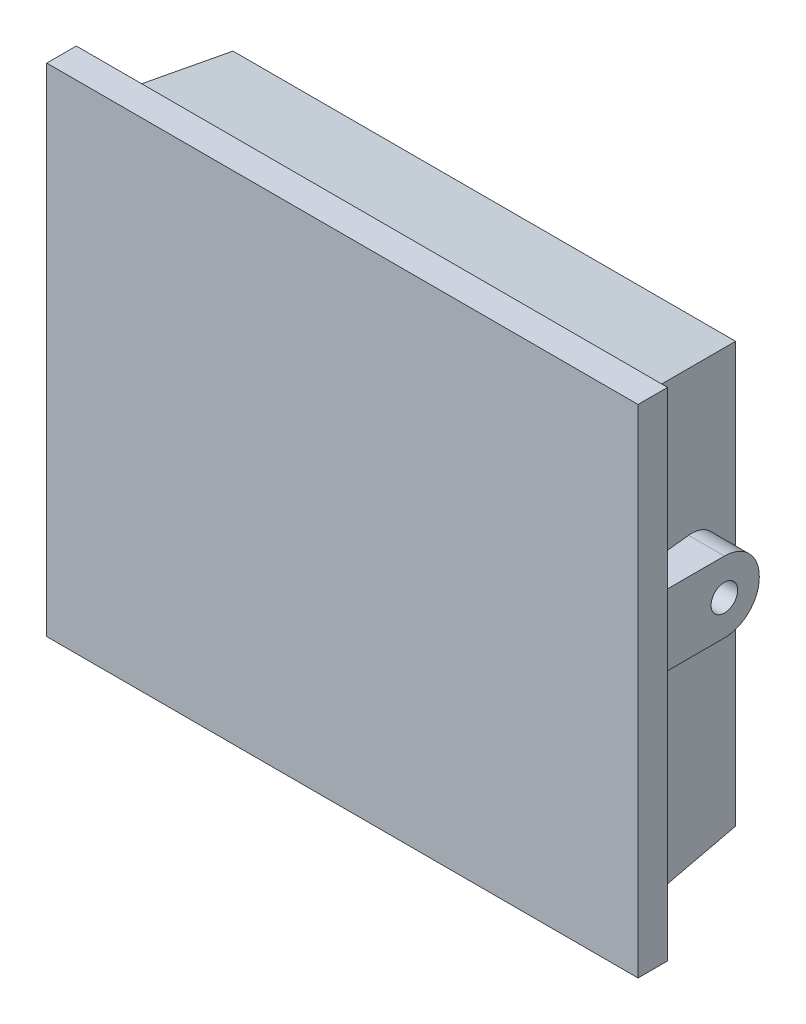
from build123d import *

# Parameters (mm, degrees)
CROQUIS1_W              = 100
CROQUIS1_H              = 84
SALIENTE_EXTRUIR1_DEPTH = 5
CROQUIS2_W              = 89
CROQUIS2_H              = 75
SALIENTE_EXTRUIR2_DEPTH = 19
SALIENTE_EXTRUIR2_TAPER = 6
CROQUIS3_R              = 2.25
SALIENTE_EXTRUIR3_DEPTH = 49.5


with BuildPart() as part:
    # Croquis1 → Saliente-Extruir1 (new body)
    with BuildSketch(Plane.XY):
        Rectangle(CROQUIS1_W, CROQUIS1_H)
    extrude(amount=SALIENTE_EXTRUIR1_DEPTH)

    # Croquis2 → Saliente-Extruir2 (add)
    with BuildSketch(Plane(origin=(0, 0, 0), x_dir=(-1, 0, 0), z_dir=(0, 0, -1))):
        Rectangle(CROQUIS2_W, CROQUIS2_H)
    extrude(amount=SALIENTE_EXTRUIR2_DEPTH, taper=SALIENTE_EXTRUIR2_TAPER)

    # Croquis3 → Saliente-Extruir3 (add, symmetric)
    with BuildSketch(Plane(origin=(0, 0, 0), x_dir=(0, 0, -1), z_dir=(1, 0, 0))):
        with BuildLine():
            Line((0, 12), (10.1, 12))
            ThreePointArc((10.1, 12), (14.271930009, 10.271930009), (16, 6.1))
            Line((16, 6.1), (16, 5.9))
            ThreePointArc((16, 5.9), (14.271930009, 1.728069991), (10.1, 0))
            Line((10.1, 0), (0, 0))
            Line((0, 0), (0, 12))
        make_face()
        with Locations((10.1, 5.9)):
            Circle(CROQUIS3_R, mode=Mode.SUBTRACT)
    extrude(amount=SALIENTE_EXTRUIR3_DEPTH, both=True)


solid = part.part
